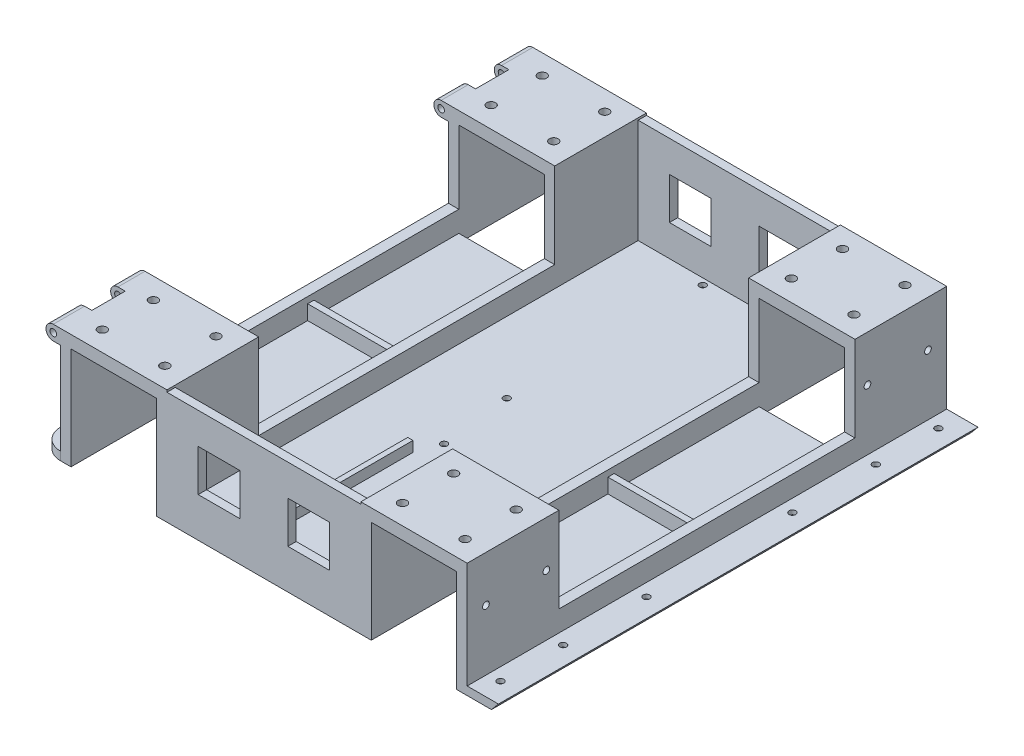
from build123d import *

# Parameters (mm, degrees)
SKETCH_1_W                       = 220
SKETCH_1_H                       = 230
EXTRUDE_1_DEPTH                  = 4
SKETCH_2_W                       = 5
SKETCH_2_H                       = 44
EXTRUDE_2_DEPTH                  = 45
SKETCH_2_3_W                     = 41
SKETCH_2_3_H                     = 44
CUT_EXTRUDE_1_DEPTH              = 4
EXTRUDE_3_DEPTH                  = 6
SKETCH_4_R                       = 2.1
CUT_EXTRUDE_2_DEPTH              = 6
SKETCH_10_W                      = 93
SKETCH_10_H                      = 4
EXTRUDE_8_DEPTH                  = 50
SKETCH_11_W                      = 5
SKETCH_11_H                      = 142
EXTRUDE_9_DEPTH                  = 10
SKETCH_13_W                      = 41
SKETCH_13_H                      = 1.5
EXTRUDE_11_DEPTH                 = 7
SKETCH_17_R                      = 1.6
CUT_EXTRUDE_7_DEPTH              = 4
CHAMFER_3_SIZE2                  = 4
CHAMFER_3_SIZE                   = 3.356398525
CUT_EXTRUDE_11_REACH             = 259.296
SKETCH_21_W                      = 20
SKETCH_21_H                      = 20
CUT_EXTRUDE_11_DIRECTION_2_DEPTH = 258.295549903
SKETCH_23_R                      = 1.6
EXTRUDE_13_DEPTH                 = 44
CUT_EXTRUDE_START                = -13
SKETCH_23_4_R                    = 1.6
CUT_EXTRUDE_13_DEPTH             = 16
EXTRUDE_START                    = 186
SKETCH_23_5_R                    = 1.6
EXTRUDE_14_DEPTH                 = 44
SKETCH_24_W                      = 2.5
SKETCH_24_H                      = 80
EXTRUDE_15_DEPTH                 = 5
SKETCH_25_R                      = 1.6
CUT_EXTRUDE_15_DEPTH             = 4
FILLET_1_R                       = 10
SKETCH_26_R                      = 1.6
CUT_EXTRUDE_16_DEPTH             = 4
SKETCH_27_R                      = 3
CUT_EXTRUDE_17_DEPTH             = 2
CUT_EXTRUDE_18_REACH             = 243.402
SKETCH_28_R                      = 1.6


with BuildPart() as part:
    # 草图1 → 凸台-拉伸1 (new body)
    with BuildSketch(Plane(origin=(0, 0, 0), x_dir=(1, 0, 0), z_dir=(0, 1, 0))):
        Rectangle(SKETCH_1_W, SKETCH_1_H)
    extrude(amount=EXTRUDE_1_DEPTH)

    # 草图2 → 凸台-拉伸2 (add)
    with BuildSketch(Plane(origin=(0, 4, 0), x_dir=(1, 0, 0), z_dir=(0, 1, 0))):
        with Locations((-97.5, -93)):
            Rectangle(SKETCH_2_W, SKETCH_2_H)
        with Locations((-51.5, -93)):
            Rectangle(SKETCH_2_W, SKETCH_2_H)
        with Locations((46.5, -93)):
            Rectangle(SKETCH_2_W, SKETCH_2_H)
        with Locations((92.5, -93)):
            Rectangle(SKETCH_2_W, SKETCH_2_H)
        with Locations((92.5, 93)):
            Rectangle(SKETCH_2_W, SKETCH_2_H)
        with Locations((46.5, 93)):
            Rectangle(SKETCH_2_W, SKETCH_2_H)
        with Locations((-51.5, 93)):
            Rectangle(SKETCH_2_W, SKETCH_2_H)
        with Locations((-97.5, 93)):
            Rectangle(SKETCH_2_W, SKETCH_2_H)
    extrude(amount=EXTRUDE_2_DEPTH)

    # 草图2<3> → 切除-拉伸1 (cut)
    with BuildSketch(Plane(origin=(0, 4, 0), x_dir=(1, 0, 0), z_dir=(0, 1, 0))):
        with Locations((-74.5, -93)):
            Rectangle(SKETCH_2_3_W, SKETCH_2_3_H)
        with Locations((69.5, -93)):
            Rectangle(SKETCH_2_3_W, SKETCH_2_3_H)
        with Locations((-74.5, 93)):
            Rectangle(SKETCH_2_3_W, SKETCH_2_3_H)
        with Locations((69.5, 93)):
            Rectangle(SKETCH_2_3_W, SKETCH_2_3_H)
    extrude(amount=-CUT_EXTRUDE_1_DEPTH, mode=Mode.SUBTRACT)

    # 草图3 → 凸台-拉伸3 (add)
    with BuildSketch(Plane(origin=(0, 49, 0), x_dir=(1, 0, 0), z_dir=(0, 1, 0))):
        Polygon((-100, -71), (-100, -115), (-49, -115), (-49, -71), (-54, -71), (-95, -71), align=None)
        Polygon((-49, 115), (-100, 115), (-100, 71), (-95, 71), (-54, 71), (-49, 71), align=None)
        Polygon((59, 115), (44, 115), (44, 71), (49, 71), (90, 71), (95, 71), (95, 115), align=None)
        Polygon((44, -71), (44, -115), (59, -115), (95, -115), (95, -71), (90, -71), (49, -71), align=None)
    extrude(amount=EXTRUDE_3_DEPTH)

    # 草图4 → 切除-拉伸2 (cut)
    with BuildSketch(Plane.XZ.offset(-49)):
        with Locations(Location((84.5, 105.5, 0), (0, 0, 270))):
            Circle(SKETCH_4_R)
        with Locations(Location((84.5, 81, 0), (0, 0, 270))):
            Circle(SKETCH_4_R)
        with Locations(Location((54.5, 105.5, 0), (0, 0, 270))):
            Circle(SKETCH_4_R)
        with Locations(Location((54.5, 81, 0), (0, 0, 270))):
            Circle(SKETCH_4_R)
        with Locations(Location((-59.5, 105.5, 0), (0, 0, 270))):
            Circle(SKETCH_4_R)
        with Locations(Location((-59.5, 81, 0), (0, 0, 270))):
            Circle(SKETCH_4_R)
        with Locations(Location((-89.5, 105.5, 0), (0, 0, 270))):
            Circle(SKETCH_4_R)
        with Locations(Location((-89.5, 81, 0), (0, 0, 270))):
            Circle(SKETCH_4_R)
        with Locations(Location((-89.5, -81, 0), (0, 0, 270))):
            Circle(SKETCH_4_R)
        with Locations(Location((-89.5, -105.5, 0), (0, 0, 270))):
            Circle(SKETCH_4_R)
        with Locations(Location((-59.5, -105.5, 0), (0, 0, 270))):
            Circle(SKETCH_4_R)
        with Locations(Location((-59.5, -81, 0), (0, 0, 270))):
            Circle(SKETCH_4_R)
        with Locations(Location((54.5, -81, 0), (0, 0, 270))):
            Circle(SKETCH_4_R)
        with Locations(Location((54.5, -105.5, 0), (0, 0, 270))):
            Circle(SKETCH_4_R)
        with Locations(Location((84.5, -105.5, 0), (0, 0, 270))):
            Circle(SKETCH_4_R)
        with Locations(Location((84.5, -81, 0), (0, 0, 270))):
            Circle(SKETCH_4_R)
    extrude(amount=-CUT_EXTRUDE_2_DEPTH, mode=Mode.SUBTRACT)

    # 草图10 → 凸台-拉伸8 (add)
    with BuildSketch(Plane(origin=(0, 4, 0), x_dir=(1, 0, 0), z_dir=(0, 1, 0))):
        with Locations((-2.5, -113)):
            Rectangle(SKETCH_10_W, SKETCH_10_H)
        with Locations((-2.5, 113)):
            Rectangle(SKETCH_10_W, SKETCH_10_H)
    extrude(amount=EXTRUDE_8_DEPTH)

    # 草图11 → 凸台-拉伸9 (add)
    with BuildSketch(Plane(origin=(0, 4, 0), x_dir=(1, 0, 0), z_dir=(0, 1, 0))):
        with Locations((-51.5, 0)):
            Rectangle(SKETCH_11_W, SKETCH_11_H)
        with Locations((92.5, 0)):
            Rectangle(SKETCH_11_W, SKETCH_11_H)
        with Locations((-97.5, 0)):
            Rectangle(SKETCH_11_W, SKETCH_11_H)
        with Locations((46.5, 0)):
            Rectangle(SKETCH_11_W, SKETCH_11_H)
    extrude(amount=EXTRUDE_9_DEPTH)

    # 草图13 → 凸台-拉伸11 (add)
    with BuildSketch(Plane(origin=(0, 4, 0), x_dir=(1, 0, 0), z_dir=(0, 1, 0))):
        with Locations((-74.5, -0.75)):
            Rectangle(SKETCH_13_W, SKETCH_13_H)
        with Locations((-74.5, 0.75)):
            Rectangle(SKETCH_13_W, SKETCH_13_H)
        with Locations((69.5, 0.75)):
            Rectangle(SKETCH_13_W, SKETCH_13_H)
        with Locations((69.5, -0.75)):
            Rectangle(SKETCH_13_W, SKETCH_13_H)
    extrude(amount=EXTRUDE_11_DEPTH)

    # 草图17 → 切除-拉伸7 (cut)
    with BuildSketch(Plane(origin=(0, 4, 0), x_dir=(1, 0, 0), z_dir=(0, 1, 0))):
        with Locations(Location((101, -35, 0), (0, 0, 270))):
            Circle(SKETCH_17_R)
        with Locations(Location((101, -75, 0), (0, 0, 270))):
            Circle(SKETCH_17_R)
        with Locations(Location((101, -105, 0), (0, 0, 270))):
            Circle(SKETCH_17_R)
        with Locations(Location((101, 35, 0), (0, 0, 270))):
            Circle(SKETCH_17_R)
        with Locations(Location((101, 75, 0), (0, 0, 270))):
            Circle(SKETCH_17_R)
        with Locations(Location((101, 105, 0), (0, 0, 270))):
            Circle(SKETCH_17_R)
    extrude(amount=-CUT_EXTRUDE_7_DEPTH, mode=Mode.SUBTRACT)

    # 倒角3
    chamfer_3_edges = [part.edges().sort_by_distance(p)[0] for p in [
        (110, 0, 0),
    ]]
    chamfer_3_side = [part.faces().sort_by_distance(p)[0] for p in [
        (109.93287203, 0, 0),
    ]]
    chamfer(chamfer_3_edges, length=CHAMFER_3_SIZE - 0.0001, length2=CHAMFER_3_SIZE2 - 0.0001, reference=chamfer_3_side[0])  # a hair under: the kernel refuses the full size

    # 切除-拉伸11: up to this face of the body (flat: up to its plane)
    cut_extrude_11_end = Plane(part.part.faces().sort_by_distance((-2.283465174, 28.568784072, -115))[0])
    # 草图21 → 切除-拉伸11 (cut, up to the picked face)
    with BuildSketch(Plane.XY.offset(-111), mode=Mode.PRIVATE) as cut_extrude_11_sk1:
        with Locations((-24, 29)):
            Rectangle(SKETCH_21_W, SKETCH_21_H)
    cut_extrude_11_tool1 = split(extrude(cut_extrude_11_sk1.sketch, amount=-CUT_EXTRUDE_11_REACH, mode=Mode.PRIVATE), bisect_by=cut_extrude_11_end, keep=Keep.BOTH, mode=Mode.PRIVATE)
    # 草图21 → 切除-拉伸11 (cut, up to the picked face)
    with BuildSketch(Plane.XY.offset(-111), mode=Mode.PRIVATE) as cut_extrude_11_sk2:
        with Locations((19, 29)):
            Rectangle(SKETCH_21_W, SKETCH_21_H)
    cut_extrude_11_tool2 = split(extrude(cut_extrude_11_sk2.sketch, amount=-CUT_EXTRUDE_11_REACH, mode=Mode.PRIVATE), bisect_by=cut_extrude_11_end, keep=Keep.BOTH, mode=Mode.PRIVATE)
    add(cut_extrude_11_tool1.solids().sort_by(Axis((-24, 29, -111), (0, 0, -1)))[0], mode=Mode.SUBTRACT)
    add(cut_extrude_11_tool2.solids().sort_by(Axis((19, 29, -111), (0, 0, -1)))[0], mode=Mode.SUBTRACT)

    # 草图21 → 切除-拉伸11 direction 2 (cut)
    with BuildSketch(Plane.XY.offset(-111)):
        with Locations((-24, 29)):
            Rectangle(SKETCH_21_W, SKETCH_21_H)
        with Locations((19, 29)):
            Rectangle(SKETCH_21_W, SKETCH_21_H)
    extrude(amount=CUT_EXTRUDE_11_DIRECTION_2_DEPTH, mode=Mode.SUBTRACT)

    # 草图23 → 凸台-拉伸13 (add)
    with BuildSketch(Plane.XY.offset(-71)):
        with BuildLine():
            Line((-100, 55), (-103.5, 55))
            ThreePointArc((-103.5, 55), (-107, 51.5), (-103.5, 48))
            Line((-103.5, 48), (-100, 48))
            Line((-100, 48), (-100, 55))
        make_face()
        with Locations((-103.5, 51.5)):
            Circle(SKETCH_23_R, mode=Mode.SUBTRACT)
    extrude(amount=-EXTRUDE_13_DEPTH)

    # 草图23<4> → 切除-拉伸13 (cut)
    with BuildSketch(Plane.XY.offset(-71).offset(CUT_EXTRUDE_START)):
        with BuildLine():
            Line((-100, 55), (-103.5, 55))
            ThreePointArc((-103.5, 55), (-107, 51.5), (-103.5, 48))
            Line((-103.5, 48), (-100, 48))
            Line((-100, 48), (-100, 55))
        make_face()
        with Locations((-103.5, 51.5)):
            Circle(SKETCH_23_4_R, mode=Mode.SUBTRACT)
    cut_extrude_13 = extrude(amount=-CUT_EXTRUDE_13_DEPTH, mode=Mode.SUBTRACT)

    # 草图23<5> → 凸台-拉伸14 (add)
    with BuildSketch(Plane.XY.offset(-71).offset(EXTRUDE_START)):
        with BuildLine():
            Line((-100, 55), (-103.5, 55))
            ThreePointArc((-103.5, 55), (-107, 51.5), (-103.5, 48))
            Line((-103.5, 48), (-100, 48))
            Line((-100, 48), (-100, 55))
        make_face()
        with Locations((-103.5, 51.5)):
            Circle(SKETCH_23_5_R, mode=Mode.SUBTRACT)
    extrude(amount=-EXTRUDE_14_DEPTH)

    # 草图24 → 凸台-拉伸15 (add)
    with BuildSketch(Plane(origin=(0, 4, 0), x_dir=(1, 0, 0), z_dir=(0, 1, 0))):
        with Locations((-16.25, -71)):
            Rectangle(SKETCH_24_W, SKETCH_24_H)
    extrude(amount=EXTRUDE_15_DEPTH)

    # 草图25 → 切除-拉伸15 (cut)
    with BuildSketch(Plane(origin=(0, 4, 0), x_dir=(1, 0, 0), z_dir=(0, 1, 0))):
        with Locations(Location((40.9, -20, 0), (0, 0, 270))):
            Circle(SKETCH_25_R)
        with Locations(Location((-11.1, -20, 0), (0, 0, 270))):
            Circle(SKETCH_25_R)
    extrude(amount=-CUT_EXTRUDE_15_DEPTH, mode=Mode.SUBTRACT)

    # 镜向6: 切除-拉伸13 across plane
    add(cut_extrude_13.mirror(Plane.XY), mode=Mode.SUBTRACT)

    # 圆角1
    fillet_1_edges = [part.edges().sort_by_distance(p)[0] for p in [
        (-110, 2, 115),
        (-110, 2, -115),
    ]]
    fillet(fillet_1_edges, radius=FILLET_1_R)

    # 草图26 → 切除-拉伸16 (cut)
    with BuildSketch(Plane(origin=(0, 4, 0), x_dir=(1, 0, 0), z_dir=(0, 1, 0))):
        with Locations(Location((41, 108, 0), (0, 0, 270))):
            Circle(SKETCH_26_R)
        with Locations(Location((41, 14, 0), (0, 0, 270))):
            Circle(SKETCH_26_R)
        with Locations(Location((-15, 14, 0), (0, 0, 270))):
            Circle(SKETCH_26_R)
        with Locations(Location((-15, 108, 0), (0, 0, 270))):
            Circle(SKETCH_26_R)
    extrude(amount=-CUT_EXTRUDE_16_DEPTH, mode=Mode.SUBTRACT)

    # 草图27 → 切除-拉伸17 (cut)
    with BuildSketch(Plane.XZ):
        with Locations(Location((101, 105, 0), (0, 0, 270))):
            Circle(SKETCH_27_R)
        with Locations(Location((101, 75, 0), (0, 0, 270))):
            Circle(SKETCH_27_R)
        with Locations(Location((101, 35, 0), (0, 0, 270))):
            Circle(SKETCH_27_R)
        with Locations(Location((101, -35, 0), (0, 0, 270))):
            Circle(SKETCH_27_R)
        with Locations(Location((101, -75, 0), (0, 0, 270))):
            Circle(SKETCH_27_R)
        with Locations(Location((101, -105, 0), (0, 0, 270))):
            Circle(SKETCH_27_R)
        with Locations(Location((40.9, 20, 0), (0, 0, 270))):
            Circle(SKETCH_27_R)
        with Locations(Location((41, -14, 0), (0, 0, 270))):
            Circle(SKETCH_27_R)
        with Locations(Location((41, -108, 0), (0, 0, 270))):
            Circle(SKETCH_27_R)
        with Locations(Location((-11.1, 20, 0), (0, 0, 270))):
            Circle(SKETCH_27_R)
        with Locations(Location((-15, -14, 0), (0, 0, 270))):
            Circle(SKETCH_27_R)
        with Locations(Location((-15, -108, 0), (0, 0, 270))):
            Circle(SKETCH_27_R)
    extrude(amount=-CUT_EXTRUDE_17_DEPTH, mode=Mode.SUBTRACT)

    # 草图28 → 切除-拉伸18 (cut, up to next)
    with BuildSketch(Plane(origin=(95, 0, 0), x_dir=(0, 0, -1), z_dir=(1, 0, 0)), mode=Mode.PRIVATE) as cut_extrude_18_sk1:
        with Locations((-106, 33)):
            Circle(SKETCH_28_R)
    cut_extrude_18_tool1 = extrude(cut_extrude_18_sk1.sketch, amount=-CUT_EXTRUDE_18_REACH, mode=Mode.PRIVATE) & part.part
    # 草图28 → 切除-拉伸18 (cut, up to next)
    with BuildSketch(Plane(origin=(95, 0, 0), x_dir=(0, 0, -1), z_dir=(1, 0, 0)), mode=Mode.PRIVATE) as cut_extrude_18_sk2:
        with Locations((-77, 33)):
            Circle(SKETCH_28_R)
    cut_extrude_18_tool2 = extrude(cut_extrude_18_sk2.sketch, amount=-CUT_EXTRUDE_18_REACH, mode=Mode.PRIVATE) & part.part
    # 草图28 → 切除-拉伸18 (cut, up to next)
    with BuildSketch(Plane(origin=(95, 0, 0), x_dir=(0, 0, -1), z_dir=(1, 0, 0)), mode=Mode.PRIVATE) as cut_extrude_18_sk3:
        with Locations((77, 33)):
            Circle(SKETCH_28_R)
    cut_extrude_18_tool3 = extrude(cut_extrude_18_sk3.sketch, amount=-CUT_EXTRUDE_18_REACH, mode=Mode.PRIVATE) & part.part
    # 草图28 → 切除-拉伸18 (cut, up to next)
    with BuildSketch(Plane(origin=(95, 0, 0), x_dir=(0, 0, -1), z_dir=(1, 0, 0)), mode=Mode.PRIVATE) as cut_extrude_18_sk4:
        with Locations((106, 33)):
            Circle(SKETCH_28_R)
    cut_extrude_18_tool4 = extrude(cut_extrude_18_sk4.sketch, amount=-CUT_EXTRUDE_18_REACH, mode=Mode.PRIVATE) & part.part
    add(cut_extrude_18_tool1.solids().sort_by_distance((95, 33, 106))[0], mode=Mode.SUBTRACT)
    add(cut_extrude_18_tool2.solids().sort_by_distance((95, 33, 77))[0], mode=Mode.SUBTRACT)
    add(cut_extrude_18_tool3.solids().sort_by_distance((95, 33, -77))[0], mode=Mode.SUBTRACT)
    add(cut_extrude_18_tool4.solids().sort_by_distance((95, 33, -106))[0], mode=Mode.SUBTRACT)


solid = part.part
